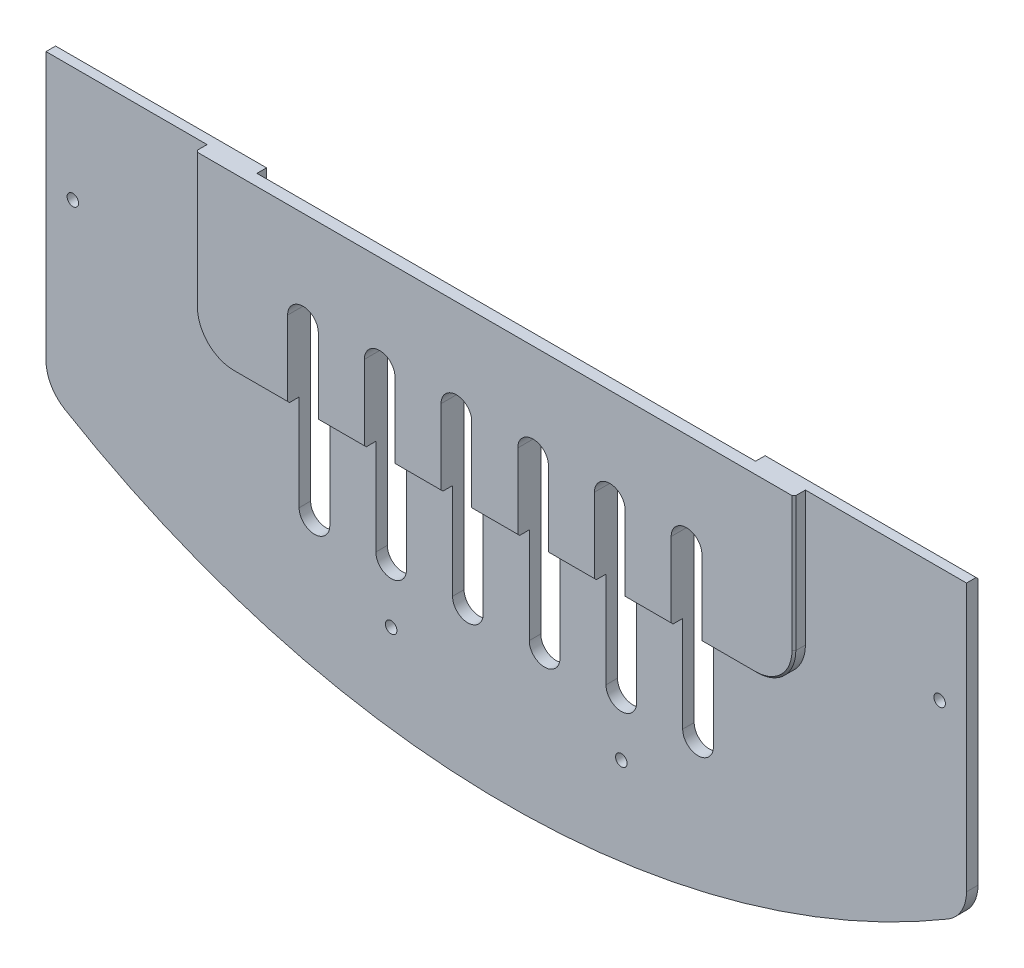
from build123d import *

# Parameters (mm, degrees)
EXTRUDE_1_DEPTH     = 3
SKETCH_2_W          = 156
SKETCH_2_H          = 45
EXTRUDE_2_DEPTH     = 3
SKETCH_3_R          = 1.5
CUT_EXTRUDE_1_DEPTH = 3
SKETCH_4_W          = 130
SKETCH_4_H          = 20
CUT_EXTRUDE_2_DEPTH = 3
FILLET_1_R          = 10
CHAMFER_1_SIZE      = 0.5
FILLET_2_R          = 10
CHAMFER_2_SIZE      = 0.5
CUT_EXTRUDE_3_DEPTH = 10


with BuildPart() as part:
    # 草图1 → 凸台-拉伸1 (new body)
    with BuildSketch(Plane.XY):
        with BuildLine():
            Line((-120, -15), (120, -15))
            Line((120, -15), (120, -90.328663107))
            ThreePointArc((120, -90.328663107), (0, -125), (-120, -90.328663107))
            Line((-120, -90.328663107), (-120, -15))
        make_face()
    extrude(amount=EXTRUDE_1_DEPTH)

    # 草图2 → 凸台-拉伸2 (add)
    with BuildSketch(Plane.XY.offset(3)):
        with Locations((0, -37.5)):
            Rectangle(SKETCH_2_W, SKETCH_2_H)
    extrude(amount=EXTRUDE_2_DEPTH)

    # 草图3 → 切除-拉伸1 (cut)
    with BuildSketch(Plane(origin=(0, 0, 0), x_dir=(-1, 0, 0), z_dir=(0, 0, -1))):
        with Locations((30, -100)):
            Circle(SKETCH_3_R)
        with Locations((113, -45)):
            Circle(SKETCH_3_R)
        with Locations((-113, -45)):
            Circle(SKETCH_3_R)
        with Locations((-30, -100)):
            Circle(SKETCH_3_R)
    extrude(amount=-CUT_EXTRUDE_1_DEPTH, mode=Mode.SUBTRACT)

    # 草图4 → 切除-拉伸2 (cut)
    with BuildSketch(Plane(origin=(0, 0, 0), x_dir=(-1, 0, 0), z_dir=(0, 0, -1))):
        with Locations((0, -25)):
            Rectangle(SKETCH_4_W, SKETCH_4_H)
    extrude(amount=-CUT_EXTRUDE_2_DEPTH, mode=Mode.SUBTRACT)

    # 圆角1
    fillet_1_edges = [part.edges().sort_by_distance(p)[0] for p in [
        (120, -90.328663107, 1.5),
        (-120, -90.328663107, 1.5),
    ]]
    fillet(fillet_1_edges, radius=FILLET_1_R)

    # 倒角1
    chamfer_1_edges = [part.edges().sort_by_distance(p)[0] for p in [
        (92.5, -15, 0),
        (-92.5, -15, 0),
        (-65, -25, 0),
        (65, -25, 0),
        (0, -35, 0),
    ]]
    chamfer(chamfer_1_edges, length=CHAMFER_1_SIZE)

    # 圆角2
    fillet_2_edges = [part.edges().sort_by_distance(p)[0] for p in [
        (-78, -60, 4.5),
        (78, -60, 4.5),
    ]]
    fillet(fillet_2_edges, radius=FILLET_2_R)

    # 倒角2
    chamfer_2_edges = [part.edges().sort_by_distance(p)[0] for p in [
        (78, -32.5, 6),
        (75.071067812, -57.071067812, 6),
        (-78, -32.5, 6),
        (0, -60, 6),
        (-75.071067812, -57.071067812, 6),
    ]]
    chamfer(chamfer_2_edges, length=CHAMFER_2_SIZE)

    # 草图5 → 切除-拉伸3 (cut)
    with BuildSketch(Plane(origin=(0, 0, 0), x_dir=(-1, 0, 0), z_dir=(0, 0, -1))):
        with BuildLine():
            Line((-46, -40), (-46, -85))
            ThreePointArc((-46, -85), (-50, -89), (-54, -85))
            Line((-54, -85), (-54, -40))
            ThreePointArc((-54, -40), (-50, -36), (-46, -40))
        make_face()
        with BuildLine():
            Line((-26, -40), (-26, -85))
            ThreePointArc((-26, -85), (-30, -89), (-34, -85))
            Line((-34, -85), (-34, -40))
            ThreePointArc((-34, -40), (-30, -36), (-26, -40))
        make_face()
        with BuildLine():
            Line((-6, -40), (-6, -85))
            ThreePointArc((-6, -85), (-10, -89), (-14, -85))
            Line((-14, -85), (-14, -40))
            ThreePointArc((-14, -40), (-10, -36), (-6, -40))
        make_face()
        with BuildLine():
            Line((6, -40), (6, -85))
            ThreePointArc((6, -85), (10, -89), (14, -85))
            Line((14, -85), (14, -40))
            ThreePointArc((14, -40), (10, -36), (6, -40))
        make_face()
        with BuildLine():
            Line((26, -40), (26, -85))
            ThreePointArc((26, -85), (30, -89), (34, -85))
            Line((34, -85), (34, -40))
            ThreePointArc((34, -40), (30, -36), (26, -40))
        make_face()
        with BuildLine():
            Line((46, -40), (46, -85))
            ThreePointArc((46, -85), (50, -89), (54, -85))
            Line((54, -85), (54, -40))
            ThreePointArc((54, -40), (50, -36), (46, -40))
        make_face()
    extrude(amount=-CUT_EXTRUDE_3_DEPTH, mode=Mode.SUBTRACT)


solid = part.part
